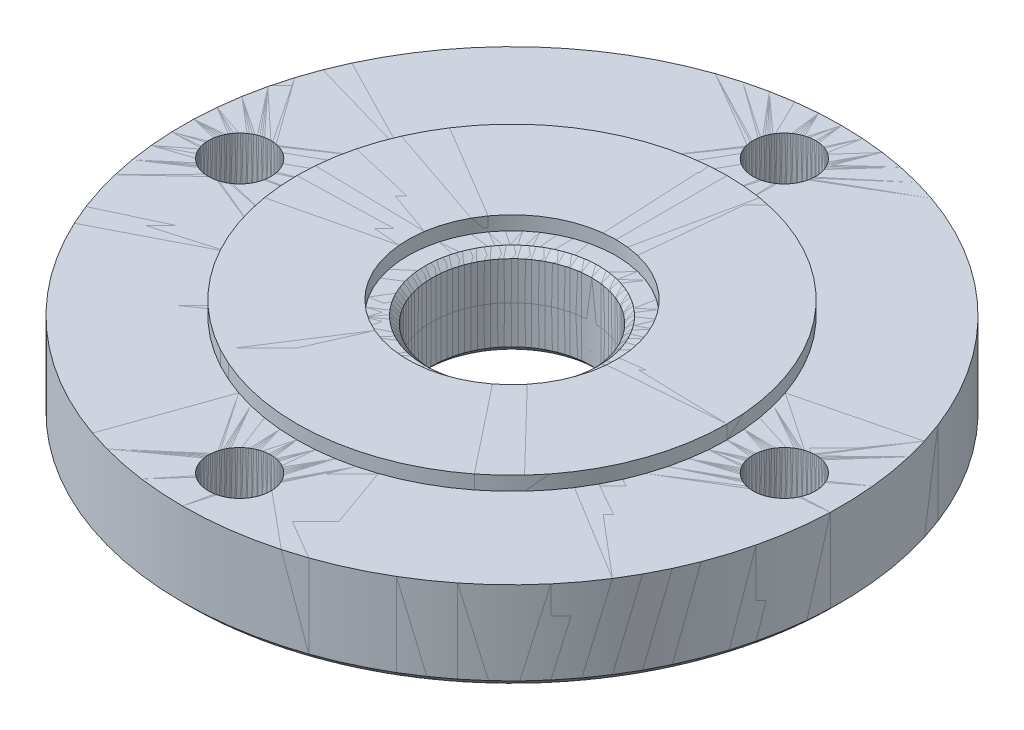
from build123d import *

# Parameters (mm, degrees)
REVOLVE_1_OUTLINE_R      = 47.5
REVOLVE_1_OUTLINE_R_2    = 11.5
REVOLVE_1_DEPTH          = 13
REVOLVE_START            = 13
REVOLVE_1_2_OUTLINE_R    = 31
REVOLVE_1_2_OUTLINE_R_2  = 15
REVOLVE_1_2_DEPTH        = 2
REVOLVE_1_3_OUTLINE_R    = 47.5
REVOLVE_1_3_OUTLINE_R_2  = 11.5
REVOLVE_1_3_DEPTH        = 13
REVOLVE_1_4_OUTLINE_R    = 31
REVOLVE_1_4_OUTLINE_R_2  = 15
REVOLVE_1_4_DEPTH        = 2
CUT_EXTRUDE_2_DEPTH      = 69.421487853
CUT_EXTRUDE_2_DEPTH_BACK = 69.421487853
SKETCH_2_R               = 4.5
CUT_EXTRUDE_3_DEPTH      = 69.82949949
CUT_EXTRUDE_3_DEPTH_BACK = 6
SKETCH_5_R               = 7
CHAMFER_2_SIZE           = 1
CHAMFER_3_SIZE           = 1
CHAMFER_4_SIZE           = 1


# Read off the part's stored shape, not the designer's step: 旋转1
with BuildPart() as part:
    # 旋转1 outline → 旋转1 (new body)
    with BuildSketch(Plane(origin=(0, 0, 0), x_dir=(1, 0, 0), z_dir=(0, 1, 0))):
        Circle(REVOLVE_1_OUTLINE_R)
        Circle(REVOLVE_1_OUTLINE_R_2, mode=Mode.SUBTRACT)
    extrude(amount=REVOLVE_1_DEPTH)

    # Revolve 1 2 outline → Revolve 1 2 (add)
    with BuildSketch(Plane(origin=(0, 0, 0), x_dir=(1, 0, 0), z_dir=(0, 1, 0)).offset(REVOLVE_START)):
        Circle(REVOLVE_1_2_OUTLINE_R)
        Circle(REVOLVE_1_2_OUTLINE_R_2, mode=Mode.SUBTRACT)
    extrude(amount=REVOLVE_1_2_DEPTH)


with BuildPart() as body_2:
    # Revolve 1 3 outline → Revolve 1 3 (new body)
    with BuildSketch(Plane(origin=(0, 0, 0), x_dir=(1, 0, 0), z_dir=(0, 1, 0))):
        Circle(REVOLVE_1_3_OUTLINE_R)
        Circle(REVOLVE_1_3_OUTLINE_R_2, mode=Mode.SUBTRACT)
    extrude(amount=REVOLVE_1_3_DEPTH)

    # Revolve 1 4 outline → Revolve 1 4 (add)
    with BuildSketch(Plane(origin=(0, 0, 0), x_dir=(1, 0, 0), z_dir=(0, 1, 0)).offset(REVOLVE_START)):
        Circle(REVOLVE_1_4_OUTLINE_R)
        Circle(REVOLVE_1_4_OUTLINE_R_2, mode=Mode.SUBTRACT)
    extrude(amount=REVOLVE_1_4_DEPTH)


with BuildPart() as cut_extrude_2_tool:
    # 草图2 → 切除-拉伸2 (new, two sides: drawn at the far end of the back side and taken through both)
    with BuildSketch(Plane(origin=(0, 13, 0), x_dir=(1, 0, 0), z_dir=(0, 1, 0)).offset(-CUT_EXTRUDE_2_DEPTH_BACK)):
        with Locations(Location((0, 39.25, 0), (0, 0, 270))):
            Circle(SKETCH_2_R)
        with Locations(Location((39.25, 0, 0), (0, 0, 270))):
            Circle(SKETCH_2_R)
        with Locations(Location((0, -39.25, 0), (0, 0, 270))):
            Circle(SKETCH_2_R)
        with Locations(Location((-39.25, 0, 0), (0, 0, 270))):
            Circle(SKETCH_2_R)
    extrude(amount=CUT_EXTRUDE_2_DEPTH + CUT_EXTRUDE_2_DEPTH_BACK)


with BuildPart() as part_1:
    add(part.part)

    # 切除-拉伸2: cut by cut_extrude_2_tool
    add(cut_extrude_2_tool.part, mode=Mode.SUBTRACT)


with BuildPart() as body_2_1:
    add(body_2.part)

    # 切除-拉伸2: cut by cut_extrude_2_tool
    add(cut_extrude_2_tool.part, mode=Mode.SUBTRACT)


with BuildPart() as cut_extrude_3_tool:
    # 草图5 → 切除-拉伸3 (new, two sides: drawn at the far end of the back side and taken through both)
    with BuildSketch(Plane.XZ.offset(-CUT_EXTRUDE_3_DEPTH_BACK)):
        with Locations(Location((0, 39.25, 0), (0, 0, 90))):
            Circle(SKETCH_5_R)
        with Locations(Location((39.25, 0, 0), (0, 0, 90))):
            Circle(SKETCH_5_R)
        with Locations(Location((0, -39.25, 0), (0, 0, 90))):
            Circle(SKETCH_5_R)
        with Locations(Location((-39.25, 0, 0), (0, 0, 90))):
            Circle(SKETCH_5_R)
    extrude(amount=CUT_EXTRUDE_3_DEPTH + CUT_EXTRUDE_3_DEPTH_BACK)


with BuildPart() as part_2:
    add(part_1.part)

    # 切除-拉伸3: cut by cut_extrude_3_tool
    add(cut_extrude_3_tool.part, mode=Mode.SUBTRACT)

    # 倒角2
    chamfer_2_edges = [part_2.edges().sort_by_distance(p)[0] for p in [
        (-11.5, 0, 0),
        (-11.5, 13, 0),
        (-47.5, 0, 0),
    ]]
    chamfer(chamfer_2_edges, length=CHAMFER_2_SIZE)


with BuildPart() as body_2_2:
    add(body_2_1.part)

    # 切除-拉伸3: cut by cut_extrude_3_tool
    add(cut_extrude_3_tool.part, mode=Mode.SUBTRACT)

    # 倒角3
    chamfer_3_edges = [body_2_2.edges().sort_by_distance(p)[0] for p in [
        (-47.5, 0, 0),
    ]]
    chamfer(chamfer_3_edges, length=CHAMFER_3_SIZE)

    # 倒角4
    chamfer_4_edges = [body_2_2.edges().sort_by_distance(p)[0] for p in [
        (-11.5, 13, 0),
        (-11.5, 0, 0),
    ]]
    chamfer(chamfer_4_edges, length=CHAMFER_4_SIZE)


solid = Compound([part_2.part, body_2_2.part])
